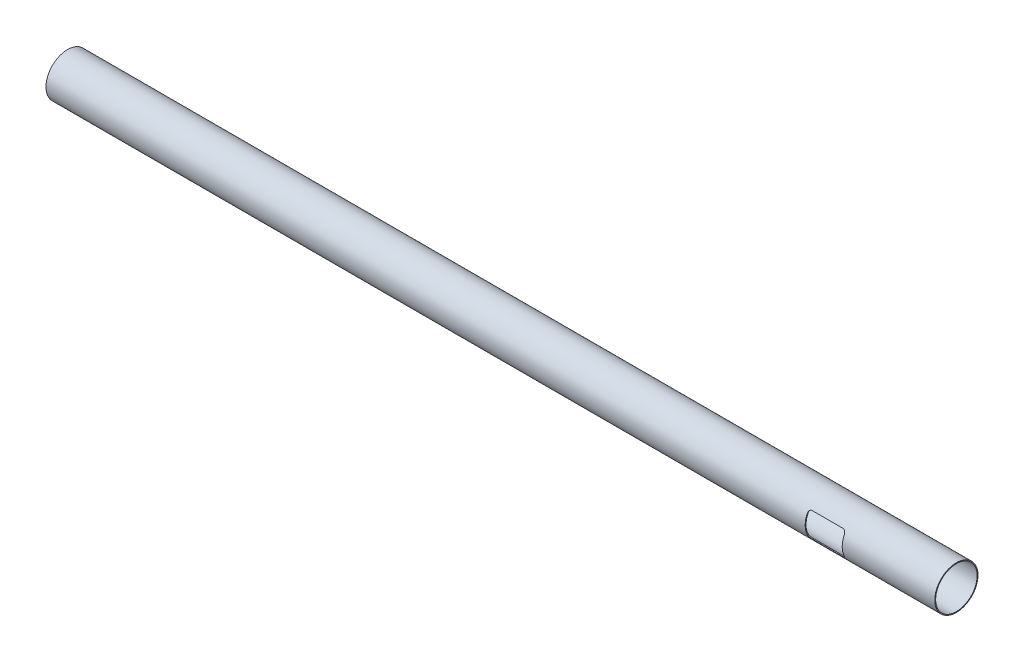
from build123d import *

# Parameters (mm, degrees)
SKETCH3_R           = 22.225
SKETCH3_R_2         = 21.336
BOSS_EXTRUDE1_DEPTH = 457.2
CUT_EXTRUDE1_DEPTH  = 459.279108459


with BuildPart() as part:
    # Sketch3 → Boss-Extrude1 (new, symmetric)
    with BuildSketch(Plane(origin=(0, 0, 0), x_dir=(0, 0, -1), z_dir=(1, 0, 0))):
        Circle(SKETCH3_R)
        Circle(SKETCH3_R_2, mode=Mode.SUBTRACT)
    extrude(amount=BOSS_EXTRUDE1_DEPTH, both=True)

    # Sketch4 → Cut-Extrude1 (cut, through all)
    with BuildSketch(Plane.XY):
        with BuildLine():
            Line((358.775, 12.7), (327.025, 12.7))
            ThreePointArc((327.025, 12.7), (324.77993597, 11.77006403), (323.85, 9.525))
            Line((323.85, 9.525), (323.85, -9.525))
            ThreePointArc((323.85, -9.525), (324.77993597, -11.77006403), (327.025, -12.7))
            Line((327.025, -12.7), (358.775, -12.7))
            ThreePointArc((358.775, -12.7), (361.02006403, -11.77006403), (361.95, -9.525))
            Line((361.95, -9.525), (361.95, 9.525))
            ThreePointArc((361.95, 9.525), (361.02006403, 11.77006403), (358.775, 12.7))
        make_face()
    extrude(amount=CUT_EXTRUDE1_DEPTH, mode=Mode.SUBTRACT)


solid = part.part
